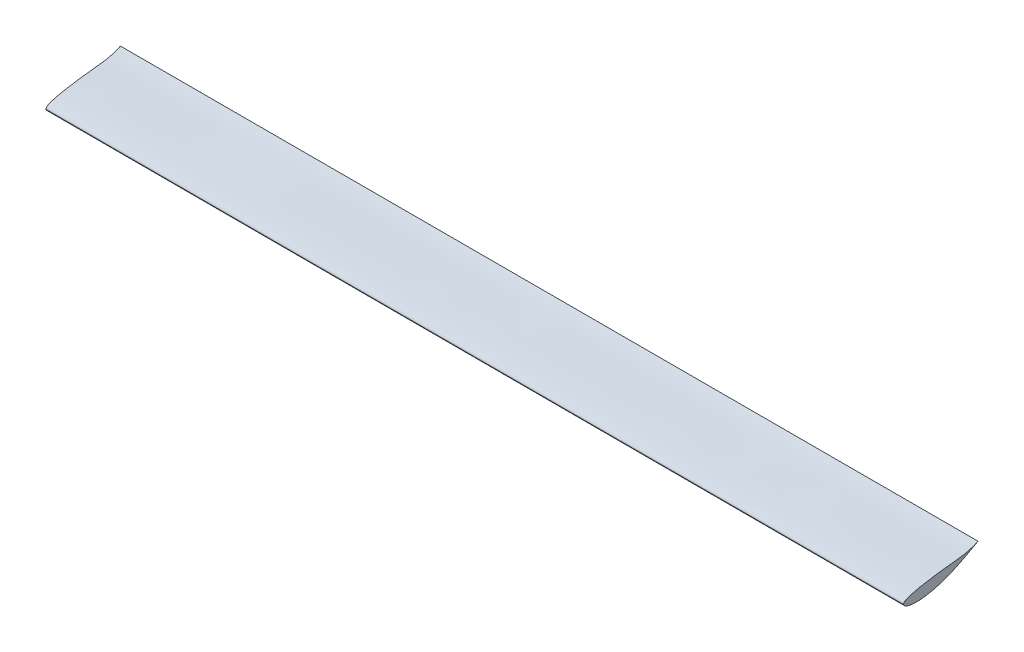
from build123d import *

# Parameters (mm, degrees)
SURFACE_KNIT1_DEPTH = 997.01975086


# Read off the part's stored shape, not the designer's step: Surface-Knit1
with BuildPart() as part:
    # Surface-Knit1 outline → Surface-Knit1 (new body)
    with BuildSketch(Plane.YZ):
        with BuildLine():
            add(Edge.make_bspline(
                [(11.926819048, -10.431513089), (10.530733839, -10.957932215), (9.245484431, -12.874056505), (8.208827939, -15.775843696), (7.663584518, -18.226405052), (7.224573018, -21.356910384), (7.057573799, -25.20500584), (7.316766094, -31.230143696), (8.314652714, -38.625859673), (10.191158268, -47.339089581), (12.667710568, -55.913427174), (15.821730649, -64.317685253), (19.505700106, -72.589210196), (23.642989418, -80.738529319), (28.047960913, -88.825477681), (31.124872026, -94.16237556), (32.624223522, -96.860765238)],
                knots=[0, 0, 0, 0, 0.043900968, 0.072493197, 0.099046398, 0.124643036, 0.174283288, 0.222881713, 0.318830353, 0.414299191, 0.509891637, 0.60612379, 0.703302687, 0.801511362, 0.900533647, 1, 1, 1, 1], degree=3))
            add(Edge.make_bspline(
                [(32.624223522, -96.860765238), (31.211458163, -94.205385638), (29.011469984, -88.632564494), (27.115883479, -79.865628087), (26.039328487, -71.008877083), (25.090494303, -62.122400107), (24.015417106, -53.250323181), (22.791594065, -44.410406561), (21.455761626, -35.601049467), (20.061518789, -28.314723008), (18.737957832, -22.53576091), (17.769530602, -18.955846373), (16.864536165, -16.120623766), (16.028601084, -14.014276669), (14.798578406, -11.627394659), (13.333079242, -10.21642952), (11.926819048, -10.431513089)],
                knots=[0, 0, 0, 0, 0.099450267, 0.197535443, 0.296052563, 0.394806357, 0.49345098, 0.591940997, 0.690286731, 0.788438582, 0.837480949, 0.886562535, 0.911178482, 0.935996246, 0.961487145, 1, 1, 1, 1], degree=3))
        make_face()
    extrude(amount=SURFACE_KNIT1_DEPTH)


solid = part.part
